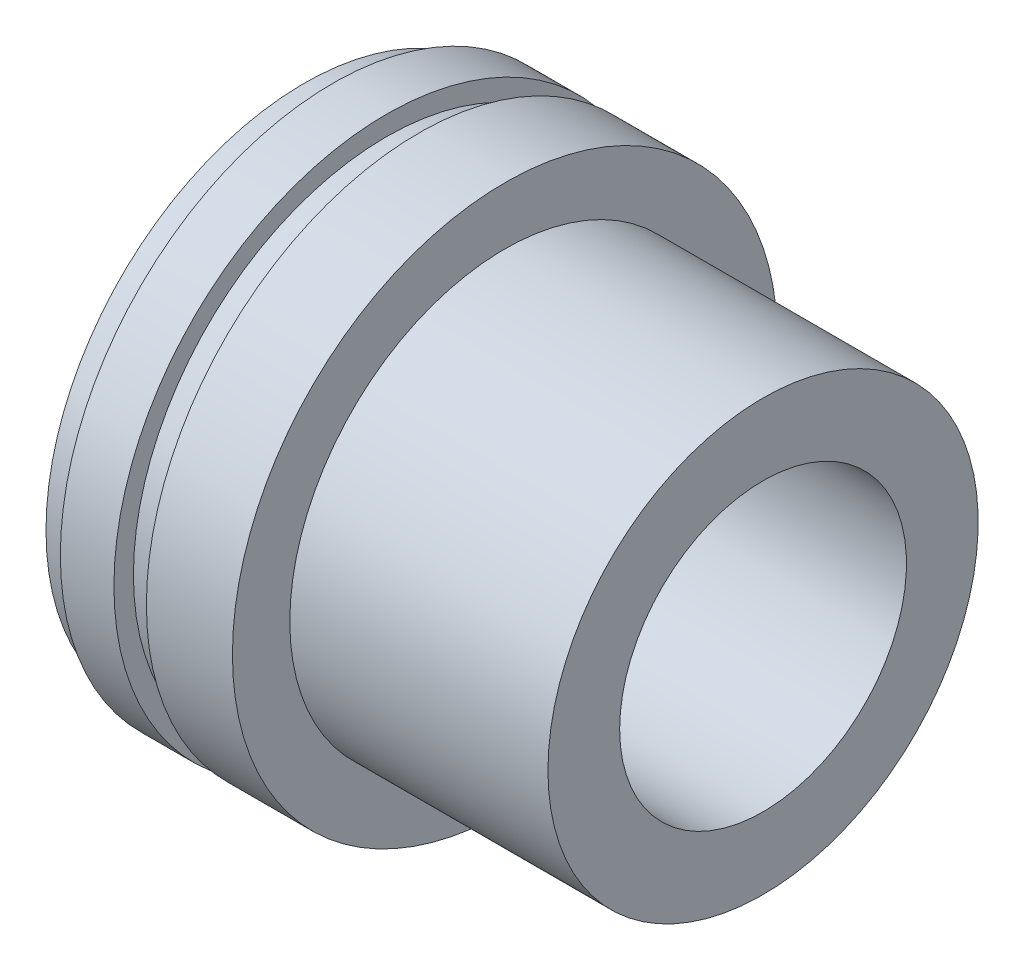
from build123d import *


with BuildPart() as part:
    # Sketch1 → Revolve1 (revolve)
    with BuildSketch(Plane.XY):
        Polygon((0, 9.525), (0, 3.175), (6.35, 3.175), (6.35, 0), (18.2118, 0), (18.2118, 4.318), (25.4, 4.318), (25.4, 0), (44.45, 0), (44.45, 12.7), (101.6, 12.7), (101.6, 28.575), (44.45, 28.575), (25.4, 9.525), align=None)
    revolve(axis=Axis((0, 60.325, 0), (1, 0, 0)))


solid = part.part
